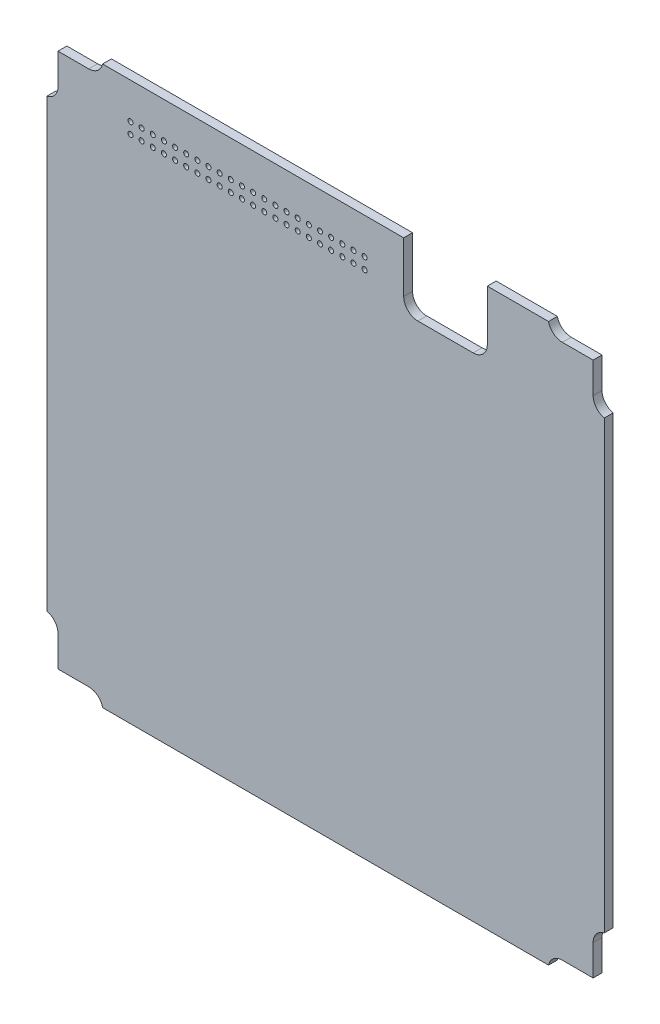
from build123d import *

# Parameters (mm, degrees)
BOSS_EXTRUDE1_DEPTH = 1.5875
FILLET1_R           = 2.54
SKETCH2_R           = 0.45
CUT_EXTRUDE1_DEPTH  = 71.728496069
SKETCH3_W           = 15
SKETCH3_H           = 1.5875
CUT_EXTRUDE2_DEPTH  = 11.652
FILLET2_R           = 2.54


with BuildPart() as part:
    # Sketch1 → Boss-Extrude1 (new body)
    with BuildSketch(Plane.XY):
        Polygon((40, 50), (-40, 50), (-40, 48), (-48, 48), (-48, 40), (-50, 40), (-50, -37.864895224), (-50, -40), (-48, -40), (-48, -48), (-40, -48), (-40, -50), (-37.864895224, -50), (40, -50), (40, -48), (48, -48), (48, -40), (50, -40), (50, 40), (48, 40), (48, 48), (40, 48), align=None)
    extrude(amount=BOSS_EXTRUDE1_DEPTH)

    # Fillet1
    # the kernel refuses this fillet: 2.54 mm, written as the material it adds along each edge
    with BuildSketch(Plane(origin=(-48, -40, 0), x_dir=(0, -1, 0), z_dir=(0, 0, 1)), Plane(origin=(40, -48, 0), x_dir=(1, 0, 0), z_dir=(0, 0, 1)), Plane(origin=(48, 40, 0), x_dir=(0, 1, 0), z_dir=(0, 0, 1)), Plane(origin=(-40, 48, 0), x_dir=(-1, 0, 0), z_dir=(0, 0, 1))) as fillet1_piece_1:
        with BuildLine():
            CenterArc((2.481934729, -2.54), FILLET1_R, 90, 77.725329785)
            Line((0, -2), (-0.049638695, -1.9892))
            ThreePointArc((-0.049638695, -1.9892), (-0.0508, -1), (-0.0508, 0))
            Line((-0.0508, 0), (0, 0.0508))
            Line((0, 0.0508), (2.481934729, 0.0508))
            Line((2.481934729, 0.0508), (2.481934729, 0))
        make_face()
    extrude(amount=1.5875)
    with BuildSketch(Plane(origin=(-40, -48, 0), x_dir=(-3.737454790095179e-12, -1.0, 0), z_dir=(0, 0, 1)), Plane(origin=(48, -40, 0), x_dir=(1.0, -3.7339020764163554e-12, 0), z_dir=(0, 0, 1)), Plane(origin=(-48, 40, 0), x_dir=(-1.0, 3.737454790095126e-12, 0), z_dir=(0, 0, 1))) as fillet1_piece_2:
        with BuildLine():
            CenterArc((2.54, -2.481934729), FILLET1_R, 102.274670215, 77.725329785)
            Line((0, -2.481934729), (-0.0508, -2.481934729))
            Line((-0.0508, -2.481934729), (-0.0508, 0))
            Line((-0.0508, 0), (0, 0.0508))
            ThreePointArc((0, 0.0508), (1, 0.0508), (1.9892, 0.049638695))
            Line((1.9892, 0.049638695), (2, 0))
        make_face()
    extrude(amount=1.5875)
    with BuildSketch(Plane(origin=(40, 48, 0), x_dir=(1, 0, 0), z_dir=(0, 0, 1))) as fillet1_piece_3:
        with BuildLine():
            CenterArc((2.481934729, 2.54), FILLET1_R, 192.274670215, 77.725329785)
            Line((0, 2), (-0.049638695, 1.9892))
            ThreePointArc((-0.049638695, 1.9892), (-0.0508, 1), (-0.0508, 0))
            Line((-0.0508, 0), (0, -0.0508))
            Line((0, -0.0508), (2.481934729, -0.0508))
            Line((2.481934729, -0.0508), (2.481934729, 0))
        make_face()
    extrude(amount=1.5875)

    # Sketch2 → Cut-Extrude1 (cut, through all)
    with BuildSketch(Plane.XY.offset(1.5875)):
        with Locations((-35, 43.55)):
            Circle(SKETCH2_R)
        with Locations((-33, 43.55)):
            Circle(SKETCH2_R)
        with Locations((-31, 43.55)):
            Circle(SKETCH2_R)
        with Locations((-29, 43.55)):
            Circle(SKETCH2_R)
        with Locations((-27, 43.55)):
            Circle(SKETCH2_R)
        with Locations((-25, 43.55)):
            Circle(SKETCH2_R)
        with Locations((-23, 43.55)):
            Circle(SKETCH2_R)
        with Locations((-21, 43.55)):
            Circle(SKETCH2_R)
        with Locations((-19, 43.55)):
            Circle(SKETCH2_R)
        with Locations((-17, 43.55)):
            Circle(SKETCH2_R)
        with Locations((-15, 43.55)):
            Circle(SKETCH2_R)
        with Locations((-13, 43.55)):
            Circle(SKETCH2_R)
        with Locations((-11, 43.55)):
            Circle(SKETCH2_R)
        with Locations((-9, 43.55)):
            Circle(SKETCH2_R)
        with Locations((-7, 43.55)):
            Circle(SKETCH2_R)
        with Locations((-5, 43.55)):
            Circle(SKETCH2_R)
        with Locations((-3, 43.55)):
            Circle(SKETCH2_R)
        with Locations((-1, 43.55)):
            Circle(SKETCH2_R)
        with Locations((1, 43.55)):
            Circle(SKETCH2_R)
        with Locations((3, 43.55)):
            Circle(SKETCH2_R)
        with Locations((5, 43.55)):
            Circle(SKETCH2_R)
        with Locations((7, 43.55)):
            Circle(SKETCH2_R)
        with Locations((-33, 41.55)):
            Circle(SKETCH2_R)
        with Locations((-31, 41.55)):
            Circle(SKETCH2_R)
        with Locations((-29, 41.55)):
            Circle(SKETCH2_R)
        with Locations((-27, 41.55)):
            Circle(SKETCH2_R)
        with Locations((-25, 41.55)):
            Circle(SKETCH2_R)
        with Locations((-23, 41.55)):
            Circle(SKETCH2_R)
        with Locations((-21, 41.55)):
            Circle(SKETCH2_R)
        with Locations((-19, 41.55)):
            Circle(SKETCH2_R)
        with Locations((-17, 41.55)):
            Circle(SKETCH2_R)
        with Locations((-15, 41.55)):
            Circle(SKETCH2_R)
        with Locations((-13, 41.55)):
            Circle(SKETCH2_R)
        with Locations((-11, 41.55)):
            Circle(SKETCH2_R)
        with Locations((-9, 41.55)):
            Circle(SKETCH2_R)
        with Locations((-7, 41.55)):
            Circle(SKETCH2_R)
        with Locations((-5, 41.55)):
            Circle(SKETCH2_R)
        with Locations((-3, 41.55)):
            Circle(SKETCH2_R)
        with Locations((-1, 41.55)):
            Circle(SKETCH2_R)
        with Locations((1, 41.55)):
            Circle(SKETCH2_R)
        with Locations((3, 41.55)):
            Circle(SKETCH2_R)
        with Locations((5, 41.55)):
            Circle(SKETCH2_R)
        with Locations((7, 41.55)):
            Circle(SKETCH2_R)
        with Locations((-35, 41.55)):
            Circle(SKETCH2_R)
    extrude(amount=-CUT_EXTRUDE1_DEPTH, mode=Mode.SUBTRACT)

    # Sketch3 → Cut-Extrude2 (cut)
    with BuildSketch(Plane(origin=(0, 50, 0), x_dir=(1, 0, 0), z_dir=(0, 1, 0))):
        with Locations((21.5125, -0.79375)):
            Rectangle(SKETCH3_W, SKETCH3_H)
    extrude(amount=-CUT_EXTRUDE2_DEPTH, mode=Mode.SUBTRACT)

    # Fillet2
    fillet2_edges = [part.edges().sort_by_distance(p)[0] for p in [
        (14.0125, 38.348, 0.79375),
        (29.0125, 38.348, 0.79375),
    ]]
    fillet(fillet2_edges, radius=FILLET2_R)


solid = part.part
